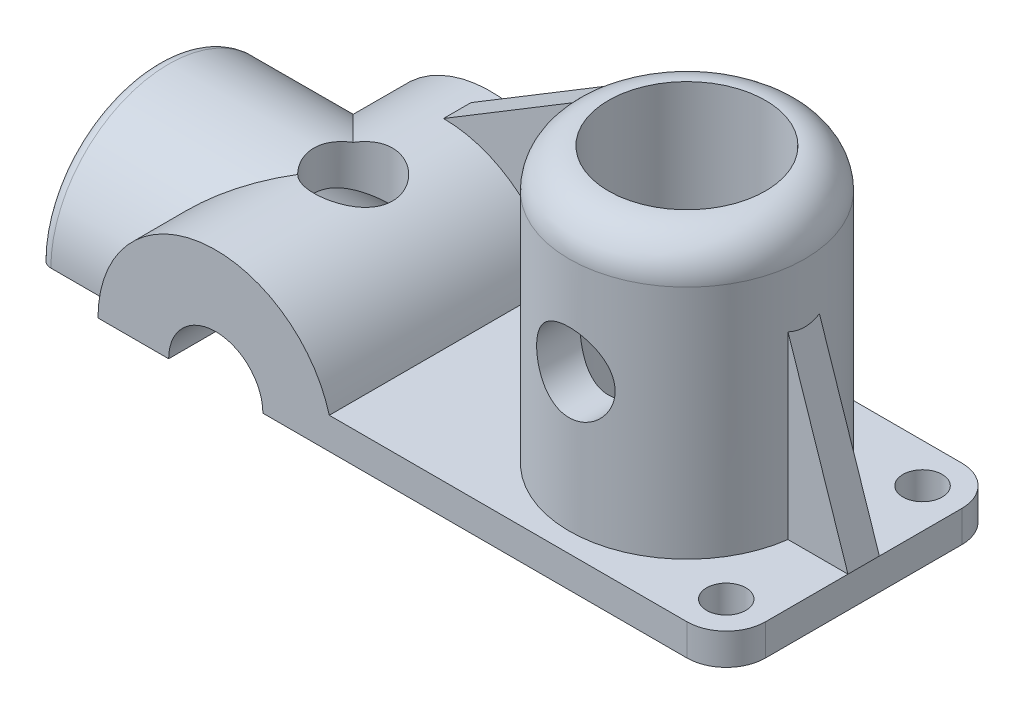
from build123d import *
from build123d.topology import SkipClean

# Parameters (mm, degrees)
SKETCH_1_R                = 30
SKETCH_1_R_2              = 20
EXTRUDE_4_DEPTH           = 78
SKETCH_1_7_R              = 5
EXTRUDE_5_DEPTH           = 8
FILLET_3_R                = 10
SKETCH_3_R                = 10
CUT_EXTRUDE_1_DEPTH       = 167.545355543
SKETCH_3_2_R              = 10
CUT_EXTRUDE_3_DEPTH       = 167.54535559
CUT_EXTRUDE_4_DEPTH       = 71
EXTRUDE_8_DEPTH           = 45.360749366
EXTRUDE_9_DEPTH           = 24.639250634
DELETE_START              = -24.639250634
DELETE_BODY_1_DEPTH       = 70
SKETCH_8_R                = 10
CUT_EXTRUDE_5_DEPTH       = 167.54535559
RIB_4_REACH               = 166.027
SKETCH_14_WALL_W          = 377.48756234
SKETCH_14_WALL_H          = 8
CUT_EXTRUDE_14_DEPTH      = 39
CUT_EXTRUDE_15_DEPTH      = 50
EXTRUDE_13_DEPTH          = 50
SKETCH_8_4_R              = 10
CUT_EXTRUDE_16_DEPTH      = 83
CUT_EXTRUDE_20_DEPTH      = 167.545355617
CUT_EXTRUDE_20_DEPTH_BACK = 167.545355617
FILLET_4_R                = 3
EXTRUDE_14_DEPTH          = 53
CUT_EXTRUDE_23_DEPTH      = 171.42229284
CUT_EXTRUDE_23_DEPTH_BACK = 171.42229284
SKETCH_22_R               = 6
SPLIT_START               = -24.628402863
SPLIT_BODIES_3_OUTLINE_W  = 12
SPLIT_BODIES_3_OUTLINE_H  = 10
SPLIT_BODIES_3_DEPTH      = 4.137034081
SPLIT_START_2             = -19.639250634
SPLIT_BODIES_3_2_DEPTH    = 7
RIB_6_REACH               = 170.505
SKETCH_32_WALLS_W         = 383.458233175
SKETCH_32_WALLS_H         = 7
FILLET_5_R                = 10
CUT_EXTRUDE_25_DEPTH      = 167.545355617
CUT_EXTRUDE_25_DEPTH_BACK = 167.545355617
SKETCH_3_4_R              = 10


# Read off the part's stored shape, not the designer's step: 实体-删除/保留 1, 分割3
with BuildPart() as part:
    # 草图1 → 凸台-拉伸4 (new body)
    with BuildSketch(Plane(origin=(0, 0, 0), x_dir=(1, 0, 0), z_dir=(0, 1, 0))):
        with Locations(Location((94.984848715, -10.360749366, 0), (0, 0, 270))):
            Circle(SKETCH_1_R)
        with Locations(Location((94.984848715, -10.360749366, 0), (0, 0, 270))):
            Circle(SKETCH_1_R_2, mode=Mode.SUBTRACT)
    extrude(amount=EXTRUDE_4_DEPTH)

    # 草图1<7> → 凸台-拉伸5 (add)
    with BuildSketch(Plane(origin=(0, 0, 0), x_dir=(1, 0, 0), z_dir=(0, 1, 0))):
        with BuildLine():
            Line((129.984848715, 24.639250634), (-20.015151285, 24.639250634))
            Line((-20.015151285, 24.639250634), (-20.015151285, -45.360749366))
            Line((-20.015151285, -45.360749366), (129.984848715, -45.360749366))
            ThreePointArc((129.984848715, -45.360749366), (137.055916527, -42.431817178), (139.984848715, -35.360749366))
            Line((139.984848715, -35.360749366), (139.984848715, 14.639250634))
            ThreePointArc((139.984848715, 14.639250634), (137.055916527, 21.710318446), (129.984848715, 24.639250634))
        make_face()
        with Locations(Location((129.984848715, -35.360749366, 0), (0, 0, 270))):
            Circle(SKETCH_1_7_R, mode=Mode.SUBTRACT)
        with BuildLine():
            ThreePointArc((64.984848715, -10.360749366), (73.77164528, 10.852454069), (94.984848715, 19.639250634))
            ThreePointArc((94.984848715, 19.639250634), (116.198052151, 10.852454069), (124.984848715, -10.360749366))
            ThreePointArc((124.984848715, -10.360749366), (94.984848715, -40.360749366), (64.984848715, -10.360749366))
        make_face(mode=Mode.SUBTRACT)
        with Locations(Location((129.984848715, 14.639250634, 0), (0, 0, 270))):
            Circle(SKETCH_1_7_R, mode=Mode.SUBTRACT)
    extrude(amount=EXTRUDE_5_DEPTH)

    # 圆角3
    fillet_3_edges = [part.edges().sort_by_distance(p)[0] for p in [
        (94.984848715, 78, -19.639250634),
    ]]
    fillet(fillet_3_edges, radius=FILLET_3_R - 0.0001)  # a hair under: the kernel refuses the full size

    # 草图3 → 切除-拉伸1 (cut, through all)
    with BuildSketch(Plane.XY):
        with Locations(Location((94.984848715, 43, 0), (0, 0, 180))):
            Circle(SKETCH_3_R)
    extrude(amount=CUT_EXTRUDE_1_DEPTH, mode=Mode.SUBTRACT)

    # 草图3<2> → 切除-拉伸3 (cut, through all)
    with BuildSketch(Plane.XY):
        with Locations(Location((94.984848715, 43, 0), (0, 0, 180))):
            Circle(SKETCH_3_2_R)
    extrude(amount=-CUT_EXTRUDE_3_DEPTH, mode=Mode.SUBTRACT)

    # 草图5 → 切除-拉伸4 (cut, symmetric)
    with BuildSketch(Plane.XY):
        with BuildLine():
            Line((-20.015151285, 0), (-2.015151285, 0))
            ThreePointArc((-2.015151285, 0), (9.984848715, 12), (21.984848715, 0))
            Line((21.984848715, 0), (39.984848715, 0))
            ThreePointArc((39.984848715, 0), (9.984848715, 30), (-20.015151285, 0))
        make_face()
    extrude(amount=CUT_EXTRUDE_4_DEPTH, both=True, mode=Mode.SUBTRACT)


with BuildPart() as cut_extrude_4_piece_1:
    # of the separate pieces the step leaves, piece 1, a body of its own (cut_extrude_4_pieces)
    add(part.part.solids().sort_by_distance((94.984848715, 8, 40.360749366))[0])


with BuildPart() as cut_extrude_4_piece_2:
    # of the separate pieces the step leaves, piece 2, a body of its own (cut_extrude_4_pieces)
    add(part.part.solids().sort_by_distance((18.929120625, 8, -24.639250634))[0])

    # Delete Body 1 outline → Delete Body 1 (cut)
    with BuildSketch(Plane.XY.offset(DELETE_START)):
        with BuildLine():
            Line((-2.015151285, 0), (21.984848715, 0))
            ThreePointArc((21.984848715, 0), (21.194917023, 4.281865077), (18.929120625, 8))
            Line((18.929120625, 8), (1.040576805, 8))
            ThreePointArc((1.040576805, 8), (-1.225219592, 4.281865077), (-2.015151285, 0))
        make_face()
    extrude(amount=DELETE_BODY_1_DEPTH, mode=Mode.SUBTRACT)


with BuildPart() as cut_extrude_4_piece_3:
    # of the separate pieces the step leaves, piece 3, a body of its own (cut_extrude_4_pieces)
    add(part.part.solids().sort_by_distance((-18.928815874, 8, -24.639250634))[0])


with BuildPart() as body_4:
    # 草图5<4> → 凸台-拉伸8 (new body)
    with BuildSketch(Plane.XY):
        with BuildLine():
            Line((-20.015151285, 0), (-2.015151285, 0))
            ThreePointArc((-2.015151285, 0), (9.984848715, 12), (21.984848715, 0))
            Line((21.984848715, 0), (39.984848715, 0))
            ThreePointArc((39.984848715, 0), (9.984848715, 30), (-20.015151285, 0))
        make_face()
    extrude(amount=EXTRUDE_8_DEPTH)


with BuildPart() as body_5:
    # 草图5<5> → 凸台-拉伸9 (new body)
    with BuildSketch(Plane.XY):
        with BuildLine():
            Line((-20.015151285, 0), (-2.015151285, 0))
            ThreePointArc((-2.015151285, 0), (9.984848715, 12), (21.984848715, 0))
            Line((21.984848715, 0), (39.984848715, 0))
            ThreePointArc((39.984848715, 0), (9.984848715, 30), (-20.015151285, 0))
        make_face()
    extrude(amount=-EXTRUDE_9_DEPTH)

    # Combine 1: union body 4
    add(body_4.part)

    # Combine 2: union 切除-拉伸4 piece 1
    add(cut_extrude_4_piece_1.part)

    # 草图8 → 切除-拉伸5 (cut, through all)
    with BuildSketch(Plane(origin=(0, 0, 0), x_dir=(1, 0, 0), z_dir=(0, 1, 0))):
        with Locations(Location((9.984848715, -10.360749366, 0), (0, 0, 90))):
            Circle(SKETCH_8_R)
    extrude(amount=CUT_EXTRUDE_5_DEPTH, mode=Mode.SUBTRACT)

    # 草图14 wall → 筋4 (add, up to next)
    with BuildSketch(Plane(origin=(132.484848715, 30.5, 10.360749366), x_dir=(0.316227766017, -0.948683298051, 0), z_dir=(0.948683298051, 0.316227766017, 0)), mode=Mode.PRIVATE) as rib_4_sk1:
        Rectangle(SKETCH_14_WALL_W, SKETCH_14_WALL_H)
    rib_4_tool1 = extrude(rib_4_sk1.sketch, amount=-RIB_4_REACH, mode=Mode.PRIVATE) - body_5.part
    add(rib_4_tool1.solids().sort_by_distance((132.484848715, 30.5, 10.360749366))[0])

    # 草图17 → 切除-拉伸14 (cut)
    with BuildSketch(Plane(origin=(-40.015151285, 0, 0), x_dir=(0, 0, -1), z_dir=(1, 0, 0))):
        with BuildLine():
            Line((9.639250634, 0), (-30.360749366, 0))
            ThreePointArc((-30.360749366, 0), (-10.360749366, 20), (9.639250634, 0))
        make_face()
    extrude(amount=CUT_EXTRUDE_14_DEPTH, mode=Mode.SUBTRACT)

    # 草图18 → 切除-拉伸15 (cut)
    with BuildSketch(Plane(origin=(-40.015151285, 0, 0), x_dir=(0, 0, -1), z_dir=(1, 0, 0))):
        with BuildLine():
            Line((9.639250634, 0), (-30.360749366, 0))
            ThreePointArc((-30.360749366, 0), (-10.360749366, 20), (9.639250634, 0))
        make_face()
    extrude(amount=CUT_EXTRUDE_15_DEPTH, mode=Mode.SUBTRACT)

    # 草图19 → 凸台-拉伸13 (add)
    with BuildSketch(Plane(origin=(-40.015151285, 0, 0), x_dir=(0, 0, -1), z_dir=(1, 0, 0))):
        with BuildLine():
            Line((9.639250634, 0), (19.639250634, 0))
            ThreePointArc((19.639250634, 0), (-10.360749366, 30), (-40.360749366, 0))
            Line((-40.360749366, 0), (-30.360749366, 0))
            ThreePointArc((-30.360749366, 0), (-10.360749366, 20), (9.639250634, 0))
        make_face()
    extrude(amount=EXTRUDE_13_DEPTH)

    # 草图8<4> → 切除-拉伸16 (cut)
    with BuildSketch(Plane(origin=(0, 0, 0), x_dir=(1, 0, 0), z_dir=(0, 1, 0))):
        with Locations(Location((9.984848715, -10.360749366, 0), (0, 0, 90))):
            Circle(SKETCH_8_4_R)
    extrude(amount=CUT_EXTRUDE_16_DEPTH, mode=Mode.SUBTRACT)

    # 草图20 → 切除-拉伸20 (cut, two sides: drawn at the far end of the back side and taken through both)
    with SkipClean():  # the faces are left unmerged after this step: merging them gives an invalid solid
        with BuildSketch(Plane.XY.offset(-CUT_EXTRUDE_20_DEPTH_BACK)):
            with BuildLine():
                Line((-2.015151285, 0), (21.984848715, 0))
                ThreePointArc((21.984848715, 0), (9.984848715, 12), (-2.015151285, 0))
            make_face()
        extrude(amount=CUT_EXTRUDE_20_DEPTH + CUT_EXTRUDE_20_DEPTH_BACK, mode=Mode.SUBTRACT)
    add(body_5.part.scale(1), mode=Mode.REPLACE)  # the faces are merged on a copy

    # 圆角4
    fillet_4_edges = [body_5.edges().sort_by_distance(p)[0] for p in [
        (-40.015151285, 30, 10.360749366),
    ]]
    fillet(fillet_4_edges, radius=FILLET_4_R)

    # 草图21 → 凸台-拉伸14 (add)
    with BuildSketch(Plane(origin=(0, 0, 0), x_dir=(1, 0, 0), z_dir=(0, 1, 0))):
        with BuildLine():
            ThreePointArc((94.984848715, 19.639250634), (73.77164528, 10.852454069), (64.984848715, -10.360749366))
            Line((64.984848715, -10.360749366), (64.984848715, 12.639250634))
            Line((64.984848715, 12.639250634), (39.984848715, 12.639250634))
            Line((39.984848715, 12.639250634), (39.984848715, 19.639250634))
            Line((39.984848715, 19.639250634), (94.984848715, 19.639250634))
        make_face()
    extrude(amount=EXTRUDE_14_DEPTH)

    # 草图22 → 切除-拉伸23 (cut, two sides: drawn at the far end of the back side and taken through both)
    with BuildSketch(Plane.XY.offset(-12.639250634).offset(-CUT_EXTRUDE_23_DEPTH_BACK)):
        with Locations((47.984848715, 43)):
            Circle(SKETCH_22_R)
    extrude(amount=CUT_EXTRUDE_23_DEPTH + CUT_EXTRUDE_23_DEPTH_BACK, mode=Mode.SUBTRACT)

    # Split Bodies 3 outline → Split Bodies 3 (cut)
    with BuildSketch(Plane(origin=(0, 0, 0), x_dir=(0.8554258292694995, 0.5179253330535097, 0), z_dir=(0.5179253330535097, -0.8554258292694996, 0)).offset(SPLIT_START)):
        with Locations((64, -16)):
            Rectangle(SPLIT_BODIES_3_OUTLINE_W, SPLIT_BODIES_3_OUTLINE_H)
    extrude(amount=SPLIT_BODIES_3_DEPTH, mode=Mode.SUBTRACT)

    # 草图32 walls → 筋6 (add, up to next)
    with BuildSketch(Plane(origin=(-10.612999001, 17.528846133, 0), x_dir=(0.8554258292694997, 0.5179253330535095, 0), z_dir=(-0.5179253330535095, 0.8554258292694997, 0)), mode=Mode.PRIVATE) as rib_6_sk1:
        with Locations((46.263286354, 16.139250634)):
            Rectangle(SKETCH_32_WALLS_W, SKETCH_32_WALLS_H)
    rib_6_tool1 = extrude(rib_6_sk1.sketch, amount=-RIB_6_REACH, mode=Mode.PRIVATE) - body_5.part
    add(rib_6_tool1.solids().sort_by_distance((28.961811093, 41.489774126, -16.139250634))[0])

    # 圆角5
    fillet_5_edges = [body_5.edges().sort_by_distance(p)[0] for p in [
        (47.972552381, 53, -16.139250634),
    ]]
    fillet(fillet_5_edges, radius=FILLET_5_R)

    # 草图3<4> → 切除-拉伸25 (cut, two sides: drawn at the far end of the back side and taken through both)
    with BuildSketch(Plane.XY.offset(-CUT_EXTRUDE_25_DEPTH_BACK)):
        with Locations(Location((94.984848715, 43, 0), (0, 0, 90))):
            Circle(SKETCH_3_4_R)
    extrude(amount=CUT_EXTRUDE_25_DEPTH + CUT_EXTRUDE_25_DEPTH_BACK, mode=Mode.SUBTRACT)


with BuildPart() as body_2:
    # Split Bodies 3 2 outline → Split Bodies 3 2 (new body)
    with BuildSketch(Plane.XY.offset(SPLIT_START_2)):
        Polygon((39.984848715, 48.163772311), (47.972552381, 53), (39.984848715, 53), align=None)
    extrude(amount=SPLIT_BODIES_3_2_DEPTH)


solid = body_5.part
